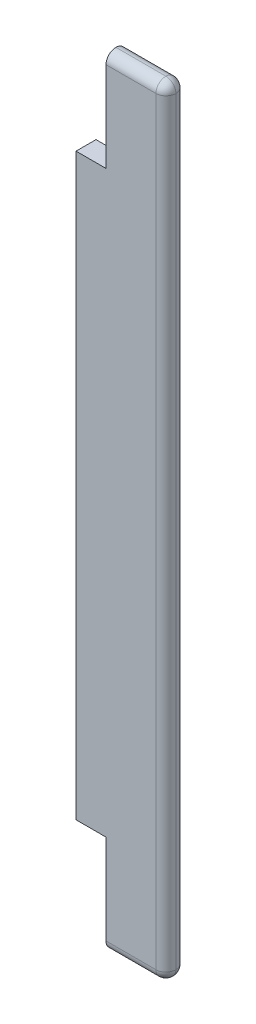
from build123d import *

# Parameters (mm, degrees)
BOSS_EXTRUDE1_DEPTH = 10
FILLET1_R           = 5
FILLET2_R           = 5
FILLET3_R           = 5


# Some blends are built 0.0001 mm under size
with BuildPart() as part:
    # Sketch1 → Boss-Extrude1 (new body)
    with BuildSketch(Plane.XY):
        Polygon((-40, -120.172625832), (-40, 169.827374168), (-25, 169.827374168), (-25, 219.827374168), (5, 219.827374168), (5, -170.172625832), (-25, -170.172625832), (-25, -120.172625832), align=None)
    extrude(amount=BOSS_EXTRUDE1_DEPTH)

    # Fillet1
    fillet1_edges = [part.edges().sort_by_distance(p)[0] for p in [
        (5, 24.827374168, 10),
        (5, 219.827374168, 5),
        (5, -170.172625832, 5),
        (5, 24.827374168, 0),
    ]]
    fillet(fillet1_edges, radius=FILLET1_R - 0.0001)  # a hair under: the kernel refuses the full size

    # Fillet2
    # the kernel refuses this fillet: 5 mm, written as the material it takes off along each edge
    with BuildSketch(Plane(origin=(5, -165.172625832, 5), x_dir=(0, -1, 0), z_dir=(0, 0, 1))) as fillet2_piece_1:
        with BuildLine():
            CenterArc((0.0001, -4.9999), 4.9999, 0, 90)
            Line((5, -4.9999), (5, 0))
            Line((5, 0), (0.0001, 0))
        make_face()
    revolve(axis=Axis((5, -165.172625832, 5), (1, 0, 0)), revolution_arc=90, mode=Mode.SUBTRACT)
    with BuildSketch(Plane(origin=(5, -165.172625832, 5), x_dir=(0, 0, 1), z_dir=(0, 1, 0))) as fillet2_piece_2:
        with BuildLine():
            CenterArc((0.0001, -4.9999), 4.9999, 0, 90)
            Line((5, -4.9999), (5, 0))
            Line((5, 0), (0.0001, 0))
        make_face()
    revolve(axis=Axis((5, -165.172625832, 5), (1, 0, 0)), revolution_arc=90, mode=Mode.SUBTRACT)
    with BuildSketch(Plane(origin=(5, -170.172625832, 0), x_dir=(0, 1, 0), z_dir=(-1, 0, 0))) as fillet2_piece_3:
        with BuildLine():
            CenterArc((FILLET2_R, -FILLET2_R), FILLET2_R, 90, 90)
            Line((0, -FILLET2_R), (0, 0))
            Line((0, 0), (FILLET2_R, 0))
        make_face()
    extrude(amount=42.5, mode=Mode.SUBTRACT)
    with BuildSketch(Plane(origin=(5, -170.172625832, 10), x_dir=(0, 1, 0), z_dir=(-1, 0, 0))) as fillet2_piece_4:
        with BuildLine():
            CenterArc((FILLET2_R, FILLET2_R), FILLET2_R, 180, 90)
            Line((0, FILLET2_R), (0, 0))
            Line((0, 0), (FILLET2_R, 0))
        make_face()
    extrude(amount=42.5, mode=Mode.SUBTRACT)

    # Fillet3
    # the kernel refuses this fillet: 5 mm, written as the material it takes off along each edge
    with BuildSketch(Plane(origin=(5, 214.827374168, 5), x_dir=(0, 0, -1), z_dir=(0, -1, 0))) as fillet3_piece_1:
        with BuildLine():
            CenterArc((0.0001, -4.9999), 4.9999, 0, 90)
            Line((5, -4.9999), (5, 0))
            Line((5, 0), (0.0001, 0))
        make_face()
    revolve(axis=Axis((5, 214.827374168, 5), (1, 0, 0)), revolution_arc=90, mode=Mode.SUBTRACT)
    with BuildSketch(Plane(origin=(5, 214.827374168, 5), x_dir=(0, 1, 0), z_dir=(0, 0, -1))) as fillet3_piece_2:
        with BuildLine():
            CenterArc((0.0001, -4.9999), 4.9999, 0, 90)
            Line((5, -4.9999), (5, 0))
            Line((5, 0), (0.0001, 0))
        make_face()
    revolve(axis=Axis((5, 214.827374168, 5), (1, 0, 0)), revolution_arc=90, mode=Mode.SUBTRACT)
    with BuildSketch(Plane(origin=(-37.5, 219.827374168, 0), x_dir=(0, 0, 1), z_dir=(1, 0, 0))) as fillet3_piece_3:
        with BuildLine():
            CenterArc((FILLET3_R, FILLET3_R), FILLET3_R, 180, 90)
            Line((0, FILLET3_R), (0, 0))
            Line((0, 0), (FILLET3_R, 0))
        make_face()
    extrude(amount=42.5, mode=Mode.SUBTRACT)
    with BuildSketch(Plane(origin=(-37.5, 219.827374168, 10), x_dir=(0, 0, -1), z_dir=(1, 0, 0))) as fillet3_piece_4:
        with BuildLine():
            CenterArc((FILLET3_R, -FILLET3_R), FILLET3_R, 90, 90)
            Line((0, -FILLET3_R), (0, 0))
            Line((0, 0), (FILLET3_R, 0))
        make_face()
    extrude(amount=42.5, mode=Mode.SUBTRACT)


solid = part.part
